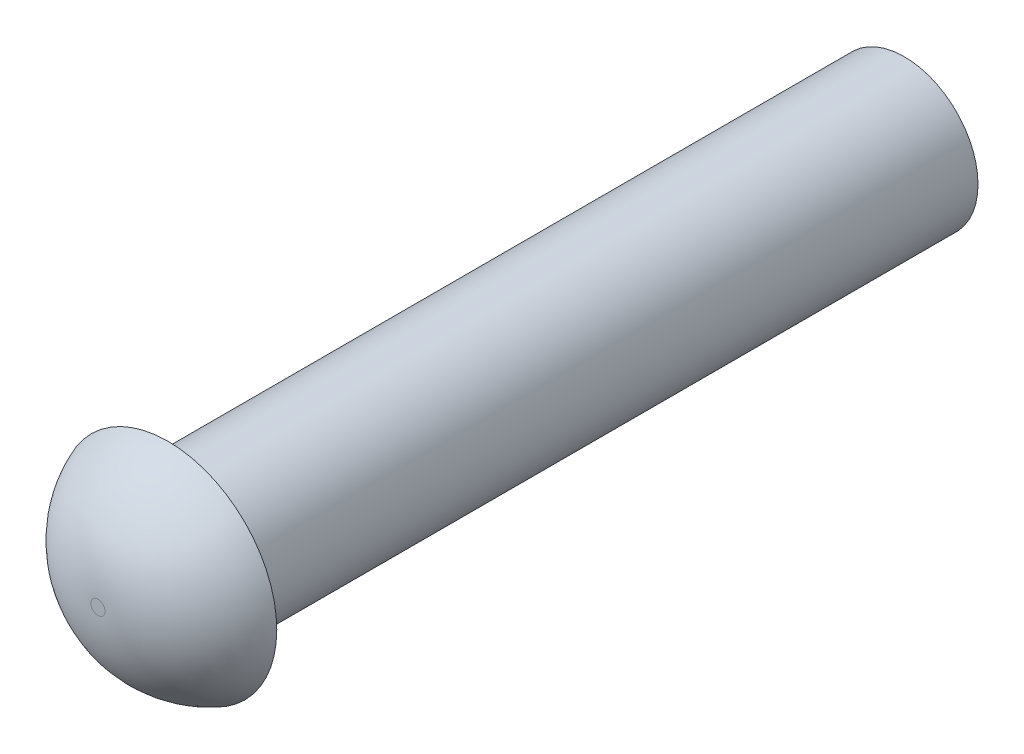
from build123d import *

# Parameters (mm, degrees)
DODANIE_WYCI_GNI_CIE1_DEPTH      = 6.5
DODANIE_WYCI_GNI_CIE1_DEPTH_BACK = 4
SZKIC1_R                         = 1.05
SZKIC2_R                         = 1.55
DODANIE_WYCI_GNI_CIE2_DEPTH      = 1
ZAOKR_GLENIE1_R                  = 1.55


with BuildPart() as part:
    # Szkic1 → Dodanie-wyciągnięcie1 (new, two sides: drawn at the far end of the back side and taken through both)
    with BuildSketch(Plane.XY.offset(-DODANIE_WYCI_GNI_CIE1_DEPTH_BACK)):
        Circle(SZKIC1_R)
    extrude(amount=DODANIE_WYCI_GNI_CIE1_DEPTH + DODANIE_WYCI_GNI_CIE1_DEPTH_BACK)

    # Szkic2 → Dodanie-wyciągnięcie2 (add)
    with BuildSketch(Plane.XY.offset(6.5)):
        Circle(SZKIC2_R)
    extrude(amount=DODANIE_WYCI_GNI_CIE2_DEPTH)

    # Zaokrąglenie1
    # the kernel refuses this fillet: 1.55 mm, written as the material it takes off along each edge
    with BuildSketch(Plane(origin=(0, 0, 7.5), x_dir=(1, 0, 0), z_dir=(0, -1, 0))) as zaokr_glenie1_piece_1:
        with BuildLine():
            CenterArc((0.100862325, -1.55), ZAOKR_GLENIE1_R, 20.783559596, 69.216440404)
            Line((0.100862325, 0), (0.100862325, 0.031))
            Line((0.100862325, 0.031), (1.55, 0.031))
            Line((1.55, 0.031), (1.581, 0))
            ThreePointArc((1.581, 0), (1.581, -0.5), (1.578982753, -0.989))
            Line((1.578982753, -0.989), (1.55, -1))
        make_face()
    revolve(axis=Axis((0, 0, 7.5), (0, 0, 1)), mode=Mode.SUBTRACT)


solid = part.part
